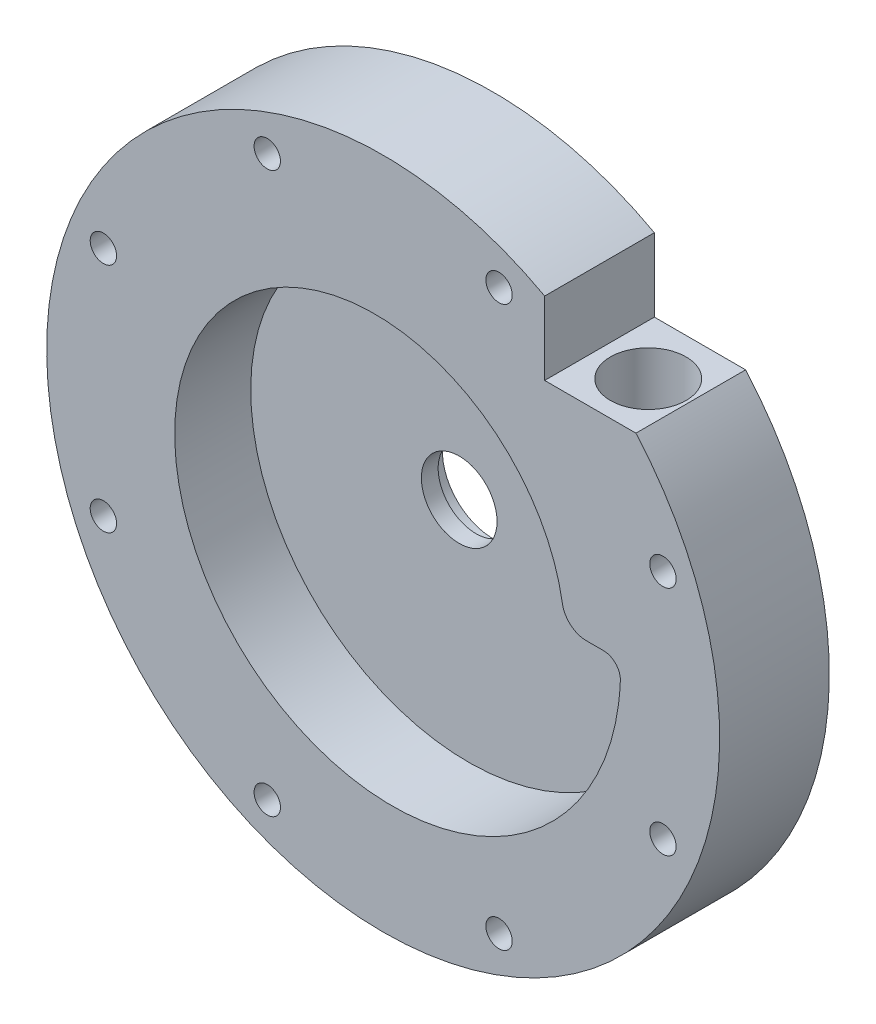
from build123d import *

# Parameters (mm, degrees)
VOLUTE_CUT_DEPTH                  = 91.942021096
CAP_CUT_DEPTH                     = 92.035204776
SKETCH28_W                        = 17.225365526
SKETCH28_H                        = 13.796548987
OUTLET_HOLE_CUT_DEPTH             = 93.157644427
PIPE_TAP_DRILL_FOR_3_8_TAP1_D     = 14.2748
PIPE_TAP_DRILL_FOR_3_8_TAP1_DEPTH = 12.7
PIPE_TAP_DRILL_FOR_3_8_TAP1_TIP   = 4.288582582
SKETCH26_R                        = 2.4892
FASTENER_HOLE_DEPTH               = 93.157644427
FASTENER_HOLES_COUNT              = 8


with BuildPart() as part:
    # Sketch22 → Main Body (revolve)
    with BuildSketch(Plane(origin=(0, 0, 0), x_dir=(1, 0, 0), z_dir=(0, 1, 0))):
        Polygon((-25.4, 0), (-7.14375, 0), (-7.14375, 3.175), (-9.525, 3.175), (-9.525, 6.35), (-63.5, 6.35), (-63.5, -14.351), (-25.4, -14.351), align=None)
    revolve(axis=Axis((0, 0, 0), (0, 0, -1)))

    # Sketch23 → Volute Cut (cut, through all)
    with BuildSketch(Plane.XY):
        with BuildLine():
            Line((38.338438787, 3.304670655), (41.593494633, 3.304670655))
            ThreePointArc((41.593494633, 3.304670655), (43.883034366, 2.328238698), (44.763213962, 0))
            add(Edge.make_bspline(
                [(34.261847842, 0), (34.264784524, 0.071844985), (34.270658697, 0.215554733), (34.277793881, 0.431212342), (34.283685604, 0.646965689), (34.292740629, 1.07883436), (34.298205408, 2.088188166), (34.244713267, 3.603653756), (34.084824015, 5.4046479), (33.844223642, 7.127751114), (33.51671457, 8.840379872), (33.102704602, 10.538150267), (32.602833338, 12.216692386), (32.017965922, 13.871662747), (31.349191468, 15.498755899), (30.5978199, 17.093716034), (29.765379241, 18.652348338), (28.85361226, 20.170530201), (27.864472781, 21.644222235), (26.800121479, 23.069479109), (25.662921186, 24.442460162), (24.455431695, 25.759439779), (23.180404062, 27.016817518), (21.840774402, 28.21112794), (20.439657201, 29.339050137), (18.980338149, 30.397416931), (17.466266506, 31.383223709), (15.90104702, 32.293636882), (14.288431416, 33.126001944), (12.632309463, 33.877851098), (10.936699661, 34.546910451), (9.205739549, 35.131106723), (7.443675663, 35.628573491), (5.654853178, 36.037656917), (3.84370524, 36.356920959), (2.014742036, 36.585152051), (0.172539606, 36.721363228), (-1.678271559, 36.764797689), (-3.533018111, 36.714931787), (-5.3869956, 36.571477434), (-7.235480366, 36.334383913), (-9.07374153, 36.003839086), (-10.897053062, 35.58027), (-12.700705888, 35.064342878), (-14.480020006, 34.456962497), (-16.230356593, 33.759270957), (-17.947130045, 32.972645827), (-19.625819949, 32.098697681), (-21.261982935, 31.139267032), (-22.851264382, 30.096420656), (-24.389409957, 28.972447316), (-25.872276938, 27.769852906), (-27.29584531, 26.491355013), (-28.656228591, 25.139876909), (-29.949684369, 23.718540989), (-31.17262451, 22.230661674), (-32.32162502, 20.679737787), (-33.393435533, 19.069444419), (-34.384988385, 17.40362431), (-35.293407272, 15.686278765), (-36.11601545, 13.921558115), (-36.850343459, 12.113751764), (-37.494136352, 10.267277823), (-38.045360401, 8.38667238), (-38.502209273, 6.476578416), (-38.863109645, 4.541734393), (-39.126726243, 2.586962555), (-39.291966303, 0.617156959), (-39.357983419, -1.362728731), (-39.324180782, -3.347693652), (-39.190213789, -5.332702333), (-38.955992027, -7.312697422), (-38.621680597, -9.282612528), (-38.187700803, -11.23738514), (-37.654730183, -13.171969596), (-37.023701879, -15.081350059), (-36.295803353, -16.960553479), (-35.472474446, -18.804662496), (-34.555404779, -20.608828259), (-33.546530503, -22.368283123), (-32.448030404, -24.078353194), (-31.26232137, -25.734470685), (-29.992053224, -27.332186055), (-28.640102943, -28.867179894), (-27.209568266, -30.335274533), (-25.70376071, -31.732445327), (-24.12619801, -33.054831606), (-22.480595995, -34.298747245), (-20.770859922, -35.460690836), (-19.001075294, -36.537355425), (-17.175498164, -37.525637795), (-15.298544973, -38.422647266), (-13.374781932, -39.225713982), (-11.408913967, -39.93239668), (-9.405773269, -40.540489886), (-7.370307471, -41.048030557), (-5.307567475, -41.453304115), (-3.222694963, -41.754849874), (-1.120909625, -41.951465843), (0.992503863, -42.042212881), (3.11220909, -42.026418195), (5.232831344, -41.903678173), (7.348971199, -41.673860539), (9.455218223, -41.337105816), (11.546164776, -40.893828104), (13.616419848, -40.344715153), (15.660622923, -39.690727741), (17.673457812, -38.93309834), (19.649666438, -38.073329092), (21.584062524, -37.113189077), (23.471545152, -36.054710891), (25.307112165, -34.900186527), (27.085873367, -33.652162581), (28.803063488, -32.313434789), (30.454054887, -30.887041888), (32.034369952, -29.376258848), (33.539693165, -27.784589454), (34.9658828, -26.115758288), (36.30898223, -24.373702093), (37.565230795, -22.562560578), (38.731074224, -20.686666652), (39.803174556, -18.750536124), (40.778419563, -16.758856904), (41.653931621, -14.716477704), (42.427076016, -12.628396291), (43.09546867, -10.499747309), (43.656983249, -8.335789696), (44.109757635, -6.141893742), (44.437890089, -4.016226935), (44.606204477, -2.433517734), (44.678884826, -1.499236103), (44.704449619, -1.124895611), (44.721871029, -0.843919777), (44.737493089, -0.562768038), (44.751475519, -0.281457909), (44.759300821, -0.093827142), (44.763213962, 0)],
                knots=[0, 0, 0, 0, 0.0008712, 0.001742639, 0.002614317, 0.003486233, 0.006976282, 0.014842882, 0.021851749, 0.028876067, 0.0359159, 0.042971309, 0.050042349, 0.057129073, 0.064231529, 0.071349764, 0.078483823, 0.085633747, 0.092799578, 0.099981356, 0.107179117, 0.1143929, 0.121622741, 0.128868673, 0.136130732, 0.14340895, 0.15070336, 0.158013994, 0.165340883, 0.172684057, 0.180043546, 0.18741938, 0.194811587, 0.202220196, 0.209645235, 0.217086731, 0.224544712, 0.232019203, 0.239510231, 0.247017823, 0.254542004, 0.262082798, 0.269640231, 0.277214328, 0.284805113, 0.29241261, 0.300036843, 0.307677836, 0.31533561, 0.323010191, 0.3307016, 0.338409861, 0.346134995, 0.353877025, 0.361635972, 0.369411859, 0.377204707, 0.385014537, 0.392841372, 0.40068523, 0.408546135, 0.416424105, 0.424319163, 0.432231327, 0.440160619, 0.448107058, 0.456070665, 0.464051459, 0.47204946, 0.480064687, 0.48809716, 0.496146898, 0.50421392, 0.512298245, 0.520399892, 0.52851888, 0.536655227, 0.544808952, 0.552980073, 0.561168609, 0.569374578, 0.577597998, 0.585838887, 0.594097262, 0.602373142, 0.610666545, 0.618977488, 0.627305988, 0.635652063, 0.64401573, 0.652397007, 0.66079591, 0.669212457, 0.677646665, 0.686098551, 0.694568131, 0.703055422, 0.711560441, 0.720083205, 0.728623729, 0.737182031, 0.745758127, 0.754352033, 0.762963766, 0.771593341, 0.780240774, 0.788906083, 0.797589282, 0.806290387, 0.815009415, 0.823746381, 0.8325013, 0.841274189, 0.850065063, 0.858873938, 0.867700829, 0.876545751, 0.885408719, 0.89428975, 0.903188858, 0.912106059, 0.921041367, 0.929994798, 0.938966366, 0.947956087, 0.956963975, 0.965990046, 0.975034314, 0.984096794, 0.992041415, 0.994313871, 0.995450526, 0.996587467, 0.997724693, 0.998862204, 1, 1, 1, 1], degree=3))
            ThreePointArc((34.261847842, 0), (34.713967842, -0.470978061), (35.166087842, 0))
            ThreePointArc((35.166087842, 0), (36.047988032, 2.32841128), (38.338438787, 3.304670655))
        make_face()
    extrude(amount=VOLUTE_CUT_DEPTH, mode=Mode.SUBTRACT)

    # Sketch25 → Cap Cut (cut, through all)
    with BuildSketch(Plane.XY.offset(8.58012)):
        with BuildLine():
            Line((41.593494633, 3.304670655), (38.338438787, 3.304670655))
            ThreePointArc((38.338438787, 3.304670655), (35.382102361, 4.389545114), (33.829218893, 7.129149209))
            add(Edge.make_bspline(
                [(33.829218893, 7.129149209), (33.734655008, 7.700712878), (33.516311109, 8.842034383), (33.102704602, 10.538150267), (32.602833338, 12.216692386), (32.017965922, 13.871662747), (31.349191468, 15.498755899), (30.5978199, 17.093716034), (29.765379241, 18.652348338), (28.85361226, 20.170530201), (27.864472781, 21.644222235), (26.800121479, 23.069479109), (25.662921186, 24.442460162), (24.455431695, 25.759439779), (23.180404062, 27.016817518), (21.840774402, 28.21112794), (20.439657201, 29.339050137), (18.980338149, 30.397416931), (17.466266506, 31.383223709), (15.90104702, 32.293636882), (14.288431416, 33.126001944), (12.632309463, 33.877851098), (10.936699661, 34.546910451), (9.205739549, 35.131106723), (7.443675663, 35.628573491), (5.654853178, 36.037656917), (3.84370524, 36.356920959), (2.014742036, 36.585152051), (0.172539606, 36.721363228), (-1.678271559, 36.764797689), (-3.533018111, 36.714931787), (-5.3869956, 36.571477434), (-7.235480366, 36.334383913), (-9.07374153, 36.003839086), (-10.897053062, 35.58027), (-12.700705888, 35.064342878), (-14.480020006, 34.456962497), (-16.230356593, 33.759270957), (-17.947130045, 32.972645827), (-19.625819949, 32.098697681), (-21.261982935, 31.139267032), (-22.851264382, 30.096420656), (-24.389409957, 28.972447316), (-25.872276938, 27.769852906), (-27.29584531, 26.491355013), (-28.656228591, 25.139876909), (-29.949684369, 23.718540989), (-31.17262451, 22.230661674), (-32.32162502, 20.679737787), (-33.393435533, 19.069444419), (-34.384988385, 17.40362431), (-35.293407272, 15.686278765), (-36.11601545, 13.921558115), (-36.850343459, 12.113751764), (-37.494136352, 10.267277823), (-38.045360401, 8.38667238), (-38.502209273, 6.476578416), (-38.863109645, 4.541734393), (-39.126726243, 2.586962555), (-39.291966303, 0.617156959), (-39.357983419, -1.362728731), (-39.324180782, -3.347693652), (-39.190213789, -5.332702333), (-38.955992027, -7.312697422), (-38.621680597, -9.282612528), (-38.187700803, -11.23738514), (-37.654730183, -13.171969596), (-37.023701879, -15.081350059), (-36.295803353, -16.960553479), (-35.472474446, -18.804662496), (-34.555404779, -20.608828259), (-33.546530503, -22.368283123), (-32.448030404, -24.078353194), (-31.26232137, -25.734470685), (-29.992053224, -27.332186055), (-28.640102943, -28.867179894), (-27.209568266, -30.335274533), (-25.70376071, -31.732445327), (-24.12619801, -33.054831606), (-22.480595995, -34.298747245), (-20.770859922, -35.460690836), (-19.001075294, -36.537355425), (-17.175498164, -37.525637795), (-15.298544973, -38.422647266), (-13.374781932, -39.225713982), (-11.408913967, -39.93239668), (-9.405773269, -40.540489886), (-7.370307471, -41.048030557), (-5.307567475, -41.453304115), (-3.222694963, -41.754849874), (-1.120909625, -41.951465843), (0.992503863, -42.042212881), (3.11220909, -42.026418195), (5.232831344, -41.903678173), (7.348971199, -41.673860539), (9.455218223, -41.337105816), (11.546164776, -40.893828104), (13.616419848, -40.344715153), (15.660622923, -39.690727741), (17.673457812, -38.93309834), (19.649666438, -38.073329092), (21.584062524, -37.113189077), (23.471545152, -36.054710891), (25.307112165, -34.900186527), (27.085873367, -33.652162581), (28.803063488, -32.313434789), (30.454054887, -30.887041888), (32.034369952, -29.376258848), (33.539693165, -27.784589454), (34.9658828, -26.115758288), (36.30898223, -24.373702093), (37.565230795, -22.562560578), (38.731074224, -20.686666652), (39.803174556, -18.750536124), (40.778419563, -16.758856904), (41.653931621, -14.716477704), (42.427076016, -12.628396291), (43.09546867, -10.499747309), (43.656983249, -8.335789696), (44.109757635, -6.141893742), (44.437890089, -4.016226935), (44.606204477, -2.433517734), (44.678884826, -1.499236103), (44.704449619, -1.124895611), (44.721871029, -0.843919777), (44.737493089, -0.562768038), (44.751475519, -0.281457909), (44.759300821, -0.093827142), (44.763213962, 0)],
                knots=[0.028896694, 0.028896694, 0.028896694, 0.028896694, 0.0359159, 0.042971309, 0.050042349, 0.057129073, 0.064231529, 0.071349764, 0.078483823, 0.085633747, 0.092799578, 0.099981356, 0.107179117, 0.1143929, 0.121622741, 0.128868673, 0.136130732, 0.14340895, 0.15070336, 0.158013994, 0.165340883, 0.172684057, 0.180043546, 0.18741938, 0.194811587, 0.202220196, 0.209645235, 0.217086731, 0.224544712, 0.232019203, 0.239510231, 0.247017823, 0.254542004, 0.262082798, 0.269640231, 0.277214328, 0.284805113, 0.29241261, 0.300036843, 0.307677836, 0.31533561, 0.323010191, 0.3307016, 0.338409861, 0.346134995, 0.353877025, 0.361635972, 0.369411859, 0.377204707, 0.385014537, 0.392841372, 0.40068523, 0.408546135, 0.416424105, 0.424319163, 0.432231327, 0.440160619, 0.448107058, 0.456070665, 0.464051459, 0.47204946, 0.480064687, 0.48809716, 0.496146898, 0.50421392, 0.512298245, 0.520399892, 0.52851888, 0.536655227, 0.544808952, 0.552980073, 0.561168609, 0.569374578, 0.577597998, 0.585838887, 0.594097262, 0.602373142, 0.610666545, 0.618977488, 0.627305988, 0.635652063, 0.64401573, 0.652397007, 0.66079591, 0.669212457, 0.677646665, 0.686098551, 0.694568131, 0.703055422, 0.711560441, 0.720083205, 0.728623729, 0.737182031, 0.745758127, 0.754352033, 0.762963766, 0.771593341, 0.780240774, 0.788906083, 0.797589282, 0.806290387, 0.815009415, 0.823746381, 0.8325013, 0.841274189, 0.850065063, 0.858873938, 0.867700829, 0.876545751, 0.885408719, 0.89428975, 0.903188858, 0.912106059, 0.921041367, 0.929994798, 0.938966366, 0.947956087, 0.956963975, 0.965990046, 0.975034314, 0.984096794, 0.992041415, 0.994313871, 0.995450526, 0.996587467, 0.997724693, 0.998862204, 1, 1, 1, 1], degree=3))
            ThreePointArc((44.763213962, 0), (43.883034366, 2.328238698), (41.593494633, 3.304670655))
        make_face()
    extrude(amount=CAP_CUT_DEPTH, mode=Mode.SUBTRACT)

    # Sketch28 → Outlet Hole Cut (cut, through all)
    with BuildSketch(Plane.XY.offset(14.351)):
        with Locations((39.092682763, 48.808274494)):
            Rectangle(SKETCH28_W, SKETCH28_H)
    extrude(amount=-OUTLET_HOLE_CUT_DEPTH, mode=Mode.SUBTRACT)

    # Sketch20 → Outlet Hole (revolve, cut)
    with BuildSketch(Plane(origin=(39.96596671, 41.91, 4.29006), x_dir=(0, 0, 1), z_dir=(1, 0, 0))):
        Polygon((0, 0), (0, 44.771598698), (4.7625, 41.91), (4.7625, 0), align=None)
    revolve(axis=Axis((39.96596671, 48.26, 4.29006), (0, -1, 0)), mode=Mode.SUBTRACT)

    # Pipe Tap Drill for 3/8 Tap1
    with Locations(Plane(origin=(39.96596671, 41.91, 4.29006), x_dir=(0, 0, 1), z_dir=(0, 1, 0))):
        with Locations((0, 0)):
            Hole(PIPE_TAP_DRILL_FOR_3_8_TAP1_D / 2, depth=PIPE_TAP_DRILL_FOR_3_8_TAP1_DEPTH)
            with Locations((0, 0, -(PIPE_TAP_DRILL_FOR_3_8_TAP1_DEPTH + PIPE_TAP_DRILL_FOR_3_8_TAP1_TIP / 2))):  # 118° drill point
                Cone(0, PIPE_TAP_DRILL_FOR_3_8_TAP1_D / 2, PIPE_TAP_DRILL_FOR_3_8_TAP1_TIP, mode=Mode.SUBTRACT)

    # Sketch26 → Fastener Hole (cut, through all)
    with BuildSketch(Plane.XY.offset(14.351)):
        with Locations((52.799715283, -21.87035816)):
            Circle(SKETCH26_R)
    fastener_hole = extrude(amount=-FASTENER_HOLE_DEPTH, mode=Mode.SUBTRACT)

    # Fastener Holes: Fastener Hole ×8 about axis
    fastener_holes_axis = Axis((0, 0, 0), (0, 0, 1))
    for i in range(1, FASTENER_HOLES_COUNT):
        add(fastener_hole.rotate(fastener_holes_axis, i * 360 / FASTENER_HOLES_COUNT), mode=Mode.SUBTRACT)


solid = part.part
